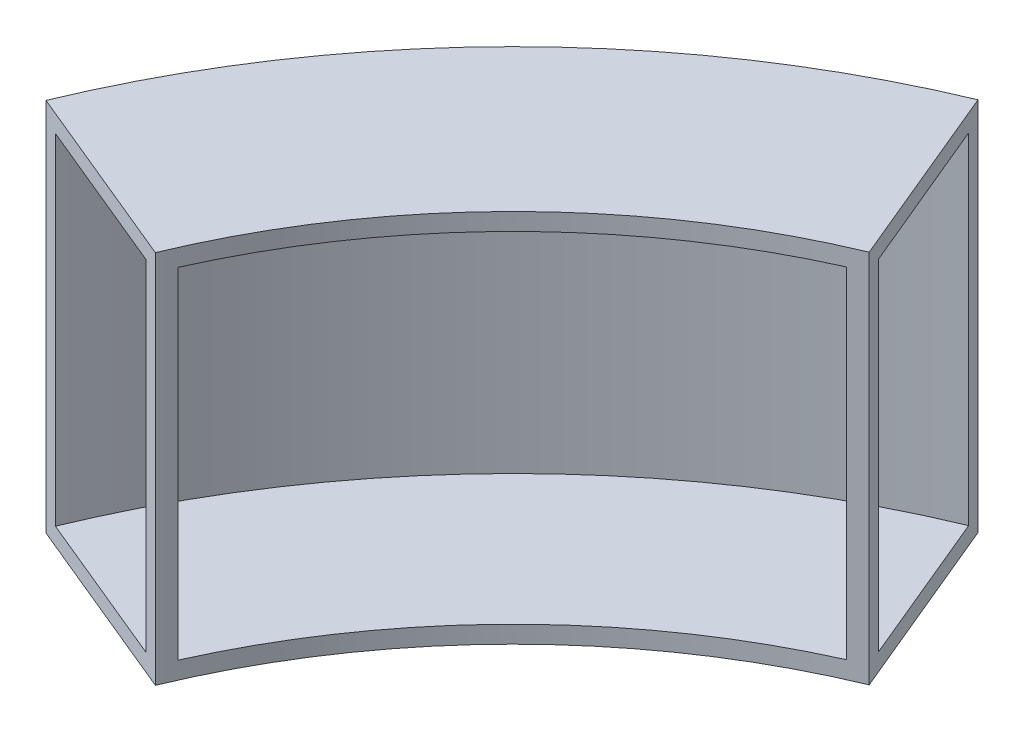
from build123d import *

# Parameters (mm, degrees)
BOSS_EXTRUDE1_DEPTH = 650
SKETCH3_W           = 290.10930009
SKETCH3_H           = 590
SKETCH4_W           = 30
SKETCH4_H           = 590
SKETCH7_W           = 30
SKETCH7_H           = 590
REVOLVE1_ANGLE      = 1.5
SKETCH8_W           = 30
SKETCH8_H           = 590
CUT_REVOLVE5_ANGLE  = 2
SKETCH9_W           = 30
SKETCH9_H           = 590
REVOLVE2_ANGLE      = 1.5


with BuildPart() as part:
    # Sketch1 → Boss-Extrude1 (new body)
    with BuildSketch(Plane(origin=(0, 0, 0), x_dir=(1, 0, 0), z_dir=(0, 1, 0))):
        with BuildLine():
            ThreePointArc((-574.625034982, 1380.741091143), (-1058.683185619, 1056.328454643), (-1382.017174823, 571.549140578))
            Line((-1382.017174823, 571.549140578), (-1058.483825136, 437.74819271))
            ThreePointArc((-1058.483825136, 437.74819271), (-810.843054874, 809.039571751), (-440.10401327, 1057.506475536))
            Line((-440.10401327, 1057.506475536), (-574.625034982, 1380.741091143))
        make_face()
    extrude(amount=BOSS_EXTRUDE1_DEPTH)

    # Sketch3 → Cut-Revolve1 (revolve, cut)
    with BuildSketch(Plane(origin=(0, 0, 0), x_dir=(0.9240924180045961, 0, 0.38216907643923637), z_dir=(-0.38216907643923637, 0, 0.9240924180045962))):
        with Locations((-1320.485349955, 325)):
            Rectangle(SKETCH3_W, SKETCH3_H)
    revolve(axis=Axis((0, 0, 0), (0, 1, 0)), mode=Mode.SUBTRACT)

    # Sketch4 → Cut-Revolve2 (revolve, cut)
    with BuildSketch(Plane(origin=(0, 0, 0), x_dir=(0.9240924180045961, 0, 0.38216907643923637), z_dir=(-0.38216907643923637, 0, 0.9240924180045962))):
        with Locations((-1160.43069991, 325)):
            Rectangle(SKETCH4_W, SKETCH4_H)
    revolve(axis=Axis((0, 0, 0), (0, 1, 0)), mode=Mode.SUBTRACT)

    # Sketch7 → Revolve1 (revolve)
    with BuildSketch(Plane(origin=(0, 0, 0), x_dir=(0.9240924180045961, 0, 0.38216907643923637), z_dir=(-0.38216907643923637, 0, 0.9240924180045962))):
        with Locations((-1160.43069991, 325)):
            Rectangle(SKETCH7_W, SKETCH7_H)
    revolve(axis=Axis((0, 0, 0), (0, -1, 0)), revolution_arc=REVOLVE1_ANGLE)

    # Sketch8 → Cut-Revolve5 (revolve, cut)
    with BuildSketch(Plane(origin=(0, 0, 0), x_dir=(-0.38422578799786455, 0, -0.9232391585268792), z_dir=(0.9232391585268792, 0, -0.38422578799786455))):
        with Locations((1160.43069991, 325)):
            Rectangle(SKETCH8_W, SKETCH8_H)
    revolve(axis=Axis((0, 0, 0), (0, 1, 0)), revolution_arc=CUT_REVOLVE5_ANGLE, mode=Mode.SUBTRACT)

    # Sketch9 → Revolve2 (revolve)
    with BuildSketch(Plane(origin=(0, 0, 0), x_dir=(-0.38422578799786455, 0, -0.9232391585268792), z_dir=(0.9232391585268792, 0, -0.38422578799786455))):
        with Locations((1160.43069991, 325)):
            Rectangle(SKETCH9_W, SKETCH9_H)
    revolve(axis=Axis((0, 0, 0), (0, 1, 0)), revolution_arc=REVOLVE2_ANGLE)


solid = part.part
